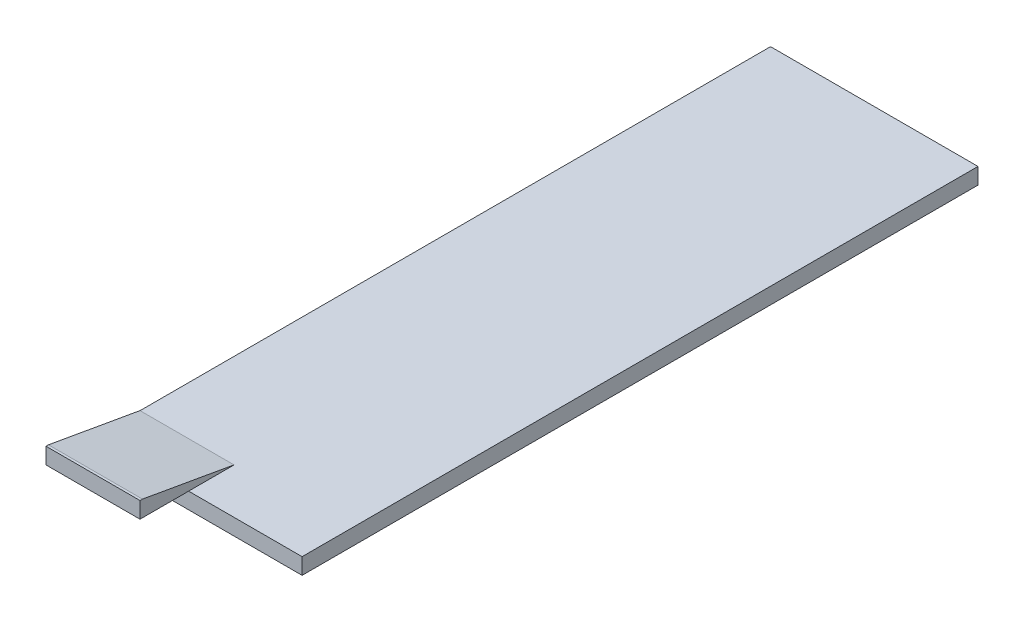
from build123d import *

# Parameters (mm, degrees)
SKETCH1_W           = 25.6
SKETCH1_H           = 83.4
BOSS_EXTRUDE1_DEPTH = 2
SKETCH2_W           = 11.6
SKETCH2_H           = 11.6
BOSS_EXTRUDE2_DEPTH = 2
CHAMFER1_SIZE       = 11.3
CHAMFER1_SIZE2      = 1.992494882


with BuildPart() as part:
    # Sketch1 → Boss-Extrude1 (new body)
    with BuildSketch(Plane(origin=(0, 0, 0), x_dir=(1, 0, 0), z_dir=(0, 1, 0))):
        with Locations((12.8, 41.7)):
            Rectangle(SKETCH1_W, SKETCH1_H)
    extrude(amount=BOSS_EXTRUDE1_DEPTH)

    # Sketch2 → Boss-Extrude2 (add)
    with BuildSketch(Plane(origin=(0, 2, 0), x_dir=(1, 0, 0), z_dir=(0, 1, 0))):
        with Locations((5.8, -0.2)):
            Rectangle(SKETCH2_W, SKETCH2_H)
    extrude(amount=BOSS_EXTRUDE2_DEPTH)

    # Chamfer1
    chamfer1_edges = [part.edges().sort_by_distance(p)[0] for p in [
        (5.8, 4, -5.6),
    ]]
    chamfer1_side = [part.faces().sort_by_distance(p)[0] for p in [
        (5.8, 4, 0.2),
    ]]
    chamfer(chamfer1_edges, length=CHAMFER1_SIZE, length2=CHAMFER1_SIZE2, reference=chamfer1_side[0])


solid = part.part
